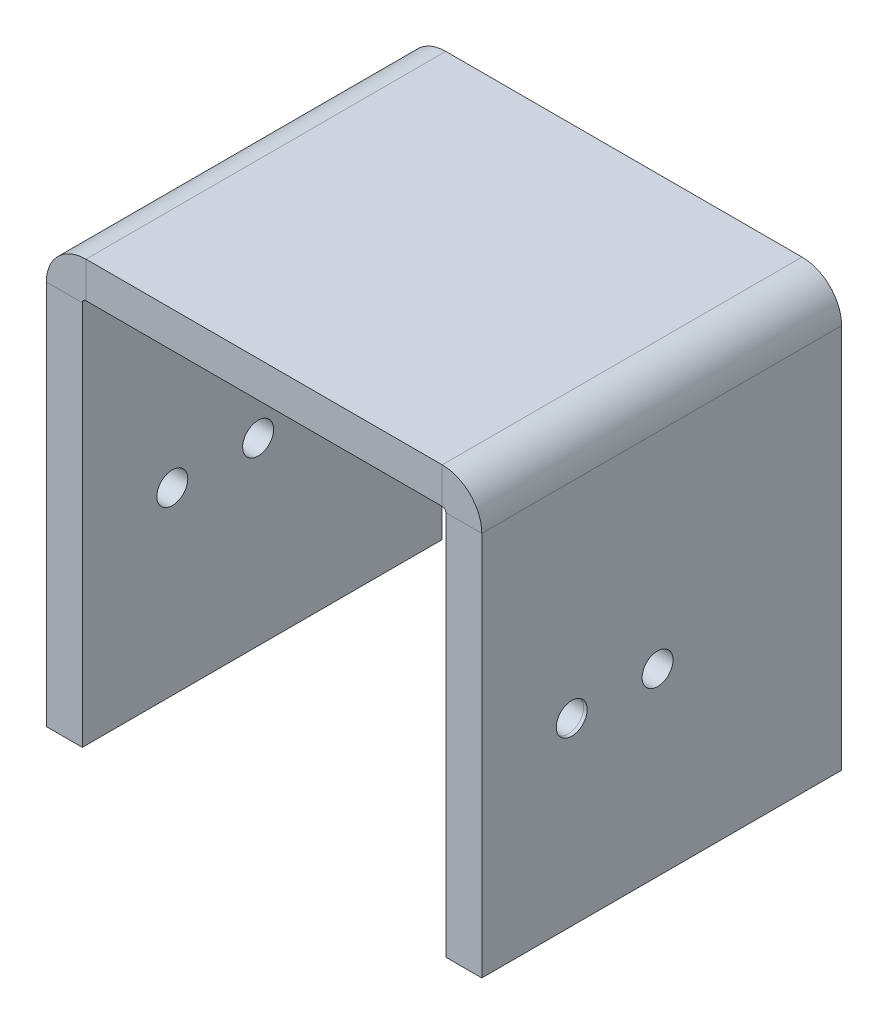
from build123d import *

# Parameters (mm, degrees)
BASE_FLANGE3_DEPTH = 50
SKETCH21_R         = 1.65
CUT_EXTRUDE1_DEPTH = 3
CIRPATTERN1_COUNT  = 4
SKETCH22_R         = 2.15
CUT_EXTRUDE4_DEPTH = 60
CUT_EXTRUDE3_START = -60
SKETCH23_R         = 2.15
CUT_EXTRUDE3_DEPTH = 60


# Read off the part's stored shape, not the designer's step: Base-Flange3
with BuildPart() as part:
    # Base-Flange3 outline → Base-Flange3 (new body)
    with BuildSketch(Plane.XY):
        with BuildLine():
            Line((-30.25, 24.5), (-30.25, -29))
            Line((-30.25, -29), (-25.25, -29))
            Line((-25.25, -29), (-25.25, 24.5))
            ThreePointArc((-25.25, 24.5), (-25.103553391, 24.853553391), (-24.75, 25))
            Line((-24.75, 25), (24.75, 25))
            ThreePointArc((24.75, 25), (25.103553391, 24.853553391), (25.25, 24.5))
            Line((25.25, 24.5), (25.25, -29))
            Line((25.25, -29), (30.25, -29))
            Line((30.25, -29), (30.25, 24.5))
            ThreePointArc((30.25, 24.5), (28.639087297, 28.389087297), (24.75, 30))
            Line((24.75, 30), (-24.75, 30))
            ThreePointArc((-24.75, 30), (-28.639087297, 28.389087297), (-30.25, 24.5))
        make_face()
    extrude(amount=BASE_FLANGE3_DEPTH)

    # Sketch21 → Cut-Extrude1 (cut)
    with BuildSketch(Plane.XZ.offset(-25)):
        with Locations(Location((-15, 40, 0), (0, 0, 270))):
            Circle(SKETCH21_R)
    cut_extrude1 = extrude(amount=-CUT_EXTRUDE1_DEPTH, mode=Mode.SUBTRACT)

    # CirPattern1: Cut-Extrude1 ×4 about axis
    cirpattern1_axis = Axis((0.052016033, 0, 24.947983967), (0, 1, 0))
    for i in range(1, CIRPATTERN1_COUNT):
        add(cut_extrude1.rotate(cirpattern1_axis, i * 360 / CIRPATTERN1_COUNT), mode=Mode.SUBTRACT)

    # Sketch22 → Cut-Extrude4 (cut)
    with BuildSketch(Plane.ZY.offset(30.25)):
        with Locations(Location((12.5, -4, 0), (0, 0, 270))):
            Circle(SKETCH22_R)
    cut_extrude4 = extrude(amount=-CUT_EXTRUDE4_DEPTH, mode=Mode.SUBTRACT)

    # Mirror2: Cut-Extrude4 across plane
    add(cut_extrude4.mirror(Plane.XY.offset(25)), mode=Mode.SUBTRACT)

    # Sketch23 → Cut-Extrude3 (cut)
    with BuildSketch(Plane(origin=(30.25, 0, 0), x_dir=(0, 0, -1), z_dir=(1, 0, 0)).offset(CUT_EXTRUDE3_START)):
        with Locations(Location((-25.574194975, -4, 0), (0, 0, 90))):
            Circle(SKETCH23_R)
        with Locations(Location((-37.5, -4, 0), (0, 0, 270))):
            Circle(SKETCH23_R)
    extrude(amount=CUT_EXTRUDE3_DEPTH, mode=Mode.SUBTRACT)


solid = part.part
